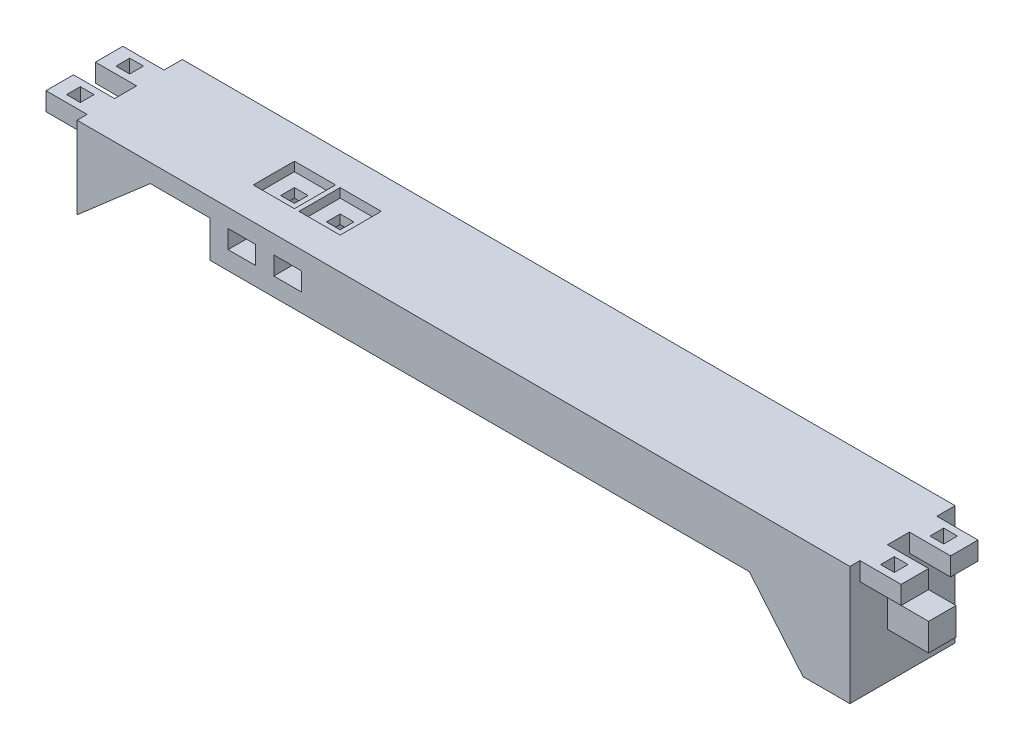
from build123d import *

# Parameters (mm, degrees)
SKETCH1_W           = 186.97
SKETCH1_H           = 23
BOSS_EXTRUDE1_DEPTH = 4
SKETCH2_W           = 10
SKETCH2_H           = 23
BOSS_EXTRUDE2_DEPTH = 22
BOSS_EXTRUDE3_DEPTH = 8
CHAMFER1_SIZE       = 14.301043111
CHAMFER1_SIZE_2     = 12
CUT_EXTRUDE1_REACH  = 191.66
SKETCH4_W           = 9
SKETCH4_H           = 4.8
SKETCH4_H_2         = 4
SKETCH4_H_3         = 2.2
SKETCH4_W_2         = 3
SKETCH4_H_4         = 3
SKETCH5_W           = 6
SKETCH5_H           = 6
BOSS_EXTRUDE4_DEPTH = 9
CUT_EXTRUDE2_REACH  = 191.66
SKETCH6_W           = 6
SKETCH6_H           = 4
CUT_EXTRUDE3_REACH  = 192.165
SKETCH7_W           = 3
SKETCH7_H           = 3
SKETCH8_W           = 16
SKETCH8_H           = 23
BOSS_EXTRUDE5_DEPTH = 14
CHAMFER2_SIZE       = 14
CHAMFER2_SIZE_2     = 16.105157701
SKETCH9_W           = 9
SKETCH9_H           = 9
CUT_EXTRUDE4_DEPTH  = 2


with BuildPart() as part:
    # Sketch1 → Boss-Extrude1 (new body)
    with BuildSketch(Plane(origin=(0, 0, 0), x_dir=(1, 0, 0), z_dir=(0, 1, 0))):
        with Locations((93.485, 11.5)):
            Rectangle(SKETCH1_W, SKETCH1_H)
    extrude(amount=BOSS_EXTRUDE1_DEPTH)

    # Sketch2 → Boss-Extrude2 (add)
    with BuildSketch(Plane.XZ):
        with Locations((172.97, -11.5)):
            Rectangle(SKETCH2_W, SKETCH2_H)
    extrude(amount=BOSS_EXTRUDE2_DEPTH)

    # Sketch3 → Boss-Extrude3 (add)
    with BuildSketch(Plane.XZ):
        Polygon((167.97, 0), (38.01, 0), (38.01, -8), (38.01, -23), (62.01, -23), (62.01, -8), (167.97, -8), align=None)
    extrude(amount=BOSS_EXTRUDE3_DEPTH)

    # Chamfer1
    # the kernel refuses this chamfer: 14.301043111, 12 mm, written as the material it adds along each edge
    with BuildSketch(Plane(origin=(167.97, -8, -8), x_dir=(0.024939322090235156, -0.9996889667359941, 0), z_dir=(0, 0, 1))) as chamfer1_piece_1_section:
        Polygon((CHAMFER1_SIZE * 0.999688966745, -CHAMFER1_SIZE * 0.0249393220905), (-CHAMFER1_SIZE_2 * 0.0249393220902, -CHAMFER1_SIZE_2 * 0.999688966736), (0, 0), align=None)
    chamfer1_piece_1 = extrude(amount=8, mode=Mode.PRIVATE)
    chamfer1_piece_1 = split(chamfer1_piece_1, bisect_by=Plane(origin=(164.021429924, -22, -4), z_dir=(0, 1, 0)), keep=Keep.TOP, mode=Mode.PRIVATE)
    add(chamfer1_piece_1)

    # Sketch4 → Cut-Extrude1 (cut, up to next)
    with BuildSketch(Plane.XZ, mode=Mode.PRIVATE) as cut_extrude1_sk1:
        with Locations((182.47, -10.6)):
            Rectangle(SKETCH4_W, SKETCH4_H)
    cut_extrude1_tool1 = extrude(cut_extrude1_sk1.sketch, amount=-CUT_EXTRUDE1_REACH, mode=Mode.PRIVATE) & part.part
    # Sketch4 → Cut-Extrude1 (cut, up to next)
    with BuildSketch(Plane.XZ, mode=Mode.PRIVATE) as cut_extrude1_sk2:
        with Locations((182.47, -21)):
            Rectangle(SKETCH4_W, SKETCH4_H_2)
    cut_extrude1_tool2 = extrude(cut_extrude1_sk2.sketch, amount=-CUT_EXTRUDE1_REACH, mode=Mode.PRIVATE) & part.part
    # Sketch4 → Cut-Extrude1 (cut, up to next)
    with BuildSketch(Plane.XZ, mode=Mode.PRIVATE) as cut_extrude1_sk3:
        with Locations((182.47, -1.1)):
            Rectangle(SKETCH4_W, SKETCH4_H_3)
    cut_extrude1_tool3 = extrude(cut_extrude1_sk3.sketch, amount=-CUT_EXTRUDE1_REACH, mode=Mode.PRIVATE) & part.part
    # Sketch4 → Cut-Extrude1 (cut, up to next)
    with BuildSketch(Plane.XZ, mode=Mode.PRIVATE) as cut_extrude1_sk4:
        with Locations((182.47, -16)):
            Rectangle(SKETCH4_W_2, SKETCH4_H_4)
    cut_extrude1_tool4 = extrude(cut_extrude1_sk4.sketch, amount=-CUT_EXTRUDE1_REACH, mode=Mode.PRIVATE) & part.part
    # Sketch4 → Cut-Extrude1 (cut, up to next)
    with BuildSketch(Plane.XZ, mode=Mode.PRIVATE) as cut_extrude1_sk5:
        with Locations((182.47, -5.2)):
            Rectangle(SKETCH4_W_2, SKETCH4_H_4)
    cut_extrude1_tool5 = extrude(cut_extrude1_sk5.sketch, amount=-CUT_EXTRUDE1_REACH, mode=Mode.PRIVATE) & part.part
    # Sketch4 → Cut-Extrude1 (cut, up to next)
    with BuildSketch(Plane.XZ, mode=Mode.PRIVATE) as cut_extrude1_sk6:
        with Locations((4.5, -1.1)):
            Rectangle(SKETCH4_W, SKETCH4_H_3)
    cut_extrude1_tool6 = extrude(cut_extrude1_sk6.sketch, amount=-CUT_EXTRUDE1_REACH, mode=Mode.PRIVATE) & part.part
    # Sketch4 → Cut-Extrude1 (cut, up to next)
    with BuildSketch(Plane.XZ, mode=Mode.PRIVATE) as cut_extrude1_sk7:
        with Locations((4.5, -5.2)):
            Rectangle(SKETCH4_W_2, SKETCH4_H_4)
    cut_extrude1_tool7 = extrude(cut_extrude1_sk7.sketch, amount=-CUT_EXTRUDE1_REACH, mode=Mode.PRIVATE) & part.part
    # Sketch4 → Cut-Extrude1 (cut, up to next)
    with BuildSketch(Plane.XZ, mode=Mode.PRIVATE) as cut_extrude1_sk8:
        with Locations((4.5, -10.6)):
            Rectangle(SKETCH4_W, SKETCH4_H)
    cut_extrude1_tool8 = extrude(cut_extrude1_sk8.sketch, amount=-CUT_EXTRUDE1_REACH, mode=Mode.PRIVATE) & part.part
    # Sketch4 → Cut-Extrude1 (cut, up to next)
    with BuildSketch(Plane.XZ, mode=Mode.PRIVATE) as cut_extrude1_sk9:
        with Locations((4.5, -16)):
            Rectangle(SKETCH4_W_2, SKETCH4_H_4)
    cut_extrude1_tool9 = extrude(cut_extrude1_sk9.sketch, amount=-CUT_EXTRUDE1_REACH, mode=Mode.PRIVATE) & part.part
    # Sketch4 → Cut-Extrude1 (cut, up to next)
    with BuildSketch(Plane.XZ, mode=Mode.PRIVATE) as cut_extrude1_sk10:
        with Locations((4.5, -21)):
            Rectangle(SKETCH4_W, SKETCH4_H_2)
    cut_extrude1_tool10 = extrude(cut_extrude1_sk10.sketch, amount=-CUT_EXTRUDE1_REACH, mode=Mode.PRIVATE) & part.part
    add(cut_extrude1_tool1.solids().sort_by_distance((182.47, 0, -10.6))[0], mode=Mode.SUBTRACT)
    add(cut_extrude1_tool2.solids().sort_by_distance((182.47, 0, -21))[0], mode=Mode.SUBTRACT)
    add(cut_extrude1_tool3.solids().sort_by_distance((182.47, 0, -1.1))[0], mode=Mode.SUBTRACT)
    add(cut_extrude1_tool4.solids().sort_by_distance((182.47, 0, -16))[0], mode=Mode.SUBTRACT)
    add(cut_extrude1_tool5.solids().sort_by_distance((182.47, 0, -5.2))[0], mode=Mode.SUBTRACT)
    add(cut_extrude1_tool6.solids().sort_by_distance((4.5, 0, -1.1))[0], mode=Mode.SUBTRACT)
    add(cut_extrude1_tool7.solids().sort_by_distance((4.5, 0, -5.2))[0], mode=Mode.SUBTRACT)
    add(cut_extrude1_tool8.solids().sort_by_distance((4.5, 0, -10.6))[0], mode=Mode.SUBTRACT)
    add(cut_extrude1_tool9.solids().sort_by_distance((4.5, 0, -16))[0], mode=Mode.SUBTRACT)
    add(cut_extrude1_tool10.solids().sort_by_distance((4.5, 0, -21))[0], mode=Mode.SUBTRACT)

    # Sketch5 → Boss-Extrude4 (add)
    with BuildSketch(Plane(origin=(177.97, 0, 0), x_dir=(0, 0, -1), z_dir=(1, 0, 0))):
        with Locations((11.2, -9)):
            Rectangle(SKETCH5_W, SKETCH5_H)
    extrude(amount=BOSS_EXTRUDE4_DEPTH)

    # Sketch6 → Cut-Extrude2 (cut, up to next)
    with BuildSketch(Plane(origin=(0, 0, -23), x_dir=(-1, 0, 0), z_dir=(0, 0, -1)), mode=Mode.PRIVATE) as cut_extrude2_sk1:
        with Locations((-55.01, -2)):
            Rectangle(SKETCH6_W, SKETCH6_H)
    cut_extrude2_tool1 = extrude(cut_extrude2_sk1.sketch, amount=-CUT_EXTRUDE2_REACH, mode=Mode.PRIVATE) & part.part
    # Sketch6 → Cut-Extrude2 (cut, up to next)
    with BuildSketch(Plane(origin=(0, 0, -23), x_dir=(-1, 0, 0), z_dir=(0, 0, -1)), mode=Mode.PRIVATE) as cut_extrude2_sk2:
        with Locations((-45.01, -2)):
            Rectangle(SKETCH6_W, SKETCH6_H)
    cut_extrude2_tool2 = extrude(cut_extrude2_sk2.sketch, amount=-CUT_EXTRUDE2_REACH, mode=Mode.PRIVATE) & part.part
    add(cut_extrude2_tool1.solids().sort_by_distance((55.01, -2, -23))[0], mode=Mode.SUBTRACT)
    add(cut_extrude2_tool2.solids().sort_by_distance((45.01, -2, -23))[0], mode=Mode.SUBTRACT)

    # Sketch7 → Cut-Extrude3 (cut, up to next)
    with BuildSketch(Plane(origin=(0, 4, 0), x_dir=(1, 0, 0), z_dir=(0, 1, 0)), mode=Mode.PRIVATE) as cut_extrude3_sk1:
        with Locations((45.01, 11.5)):
            Rectangle(SKETCH7_W, SKETCH7_H)
    cut_extrude3_tool1 = extrude(cut_extrude3_sk1.sketch, amount=-CUT_EXTRUDE3_REACH, mode=Mode.PRIVATE) & part.part
    # Sketch7 → Cut-Extrude3 (cut, up to next)
    with BuildSketch(Plane(origin=(0, 4, 0), x_dir=(1, 0, 0), z_dir=(0, 1, 0)), mode=Mode.PRIVATE) as cut_extrude3_sk2:
        with Locations((55.01, 11.5)):
            Rectangle(SKETCH7_W, SKETCH7_H)
    cut_extrude3_tool2 = extrude(cut_extrude3_sk2.sketch, amount=-CUT_EXTRUDE3_REACH, mode=Mode.PRIVATE) & part.part
    add(cut_extrude3_tool1.solids().sort_by_distance((45.01, 4, -11.5))[0], mode=Mode.SUBTRACT)
    add(cut_extrude3_tool2.solids().sort_by_distance((55.01, 4, -11.5))[0], mode=Mode.SUBTRACT)

    # Sketch8 → Boss-Extrude5 (add)
    with BuildSketch(Plane.XZ):
        with Locations((17, -11.5)):
            Rectangle(SKETCH8_W, SKETCH8_H)
    extrude(amount=BOSS_EXTRUDE5_DEPTH)

    # Chamfer2
    # the kernel refuses this chamfer: 16.105157701, 14 mm, written as the material it takes off along each edge
    with BuildSketch(Plane(origin=(25, -14, 41.491821244), x_dir=(0.033690971337926715, 0.9994322980824198, 0), z_dir=(0, 0, -1))) as chamfer2_piece_1_section:
        Polygon((CHAMFER2_SIZE * 0.999432298082, -CHAMFER2_SIZE * 0.0336909713379), (-CHAMFER2_SIZE_2 * 0.0336909713381, -CHAMFER2_SIZE_2 * 0.999432298088), (0, 0), align=None)
    chamfer2_piece_1 = extrude(amount=105.983642488, mode=Mode.PRIVATE)
    chamfer2_piece_1 = split(chamfer2_piece_1, bisect_by=Plane(origin=(19.65817275, 0, -11.5), z_dir=(0, -1, 0)), keep=Keep.TOP, mode=Mode.PRIVATE)
    add(chamfer2_piece_1, mode=Mode.SUBTRACT)

    # Sketch9 → Cut-Extrude4 (cut)
    with BuildSketch(Plane(origin=(0, 4, 0), x_dir=(1, 0, 0), z_dir=(0, 1, 0))):
        with Locations((45.01, 11.5)):
            Rectangle(SKETCH9_W, SKETCH9_H)
        with Locations((55.01, 11.5)):
            Rectangle(SKETCH9_W, SKETCH9_H)
    extrude(amount=-CUT_EXTRUDE4_DEPTH, mode=Mode.SUBTRACT)


solid = part.part
